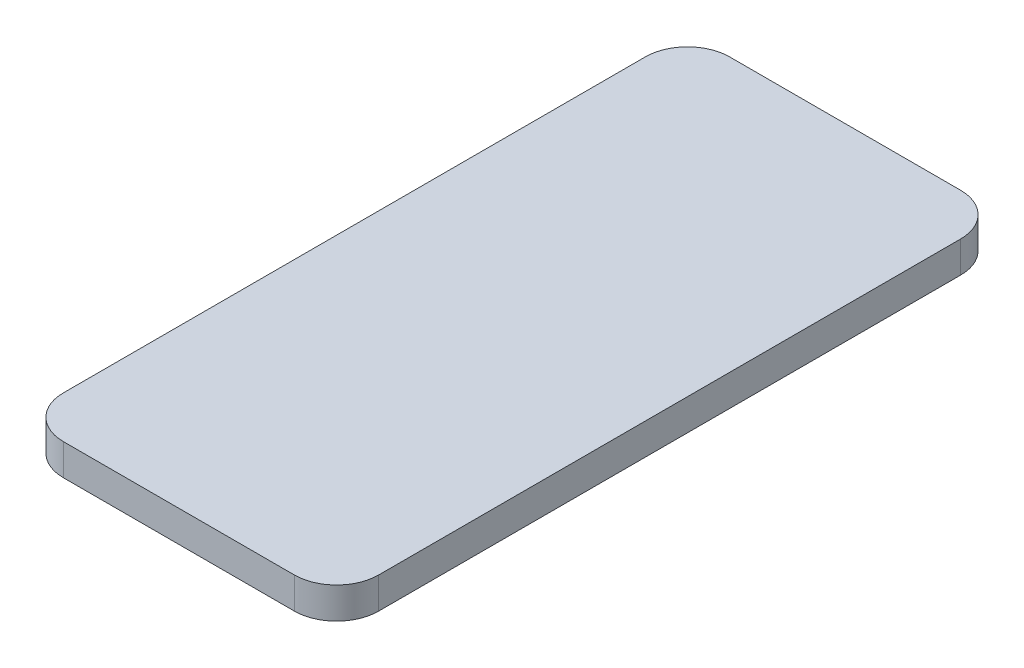
from build123d import *

# Parameters (mm, degrees)
F_01_PHONE_BODY_DEPTH = 7.42


with BuildPart() as part:
    # 草图1 → 01_PHONE_BODY (new body)
    with BuildSketch(Plane(origin=(0, 0, 0), x_dir=(1, 0, 0), z_dir=(0, 1, 0))):
        with BuildLine():
            Line((-27.365, 0), (27.365, 0))
            ThreePointArc((27.365, 0), (34.436067812, -2.928932188), (37.365, -10))
            Line((37.365, -10), (37.365, -147.9))
            ThreePointArc((37.365, -147.9), (34.436067812, -154.971067812), (27.365, -157.9))
            Line((27.365, -157.9), (-27.365, -157.9))
            ThreePointArc((-27.365, -157.9), (-34.436067812, -154.971067812), (-37.365, -147.9))
            Line((-37.365, -147.9), (-37.365, -10))
            ThreePointArc((-37.365, -10), (-34.436067812, -2.928932188), (-27.365, 0))
        make_face()
    extrude(amount=-F_01_PHONE_BODY_DEPTH)


solid = part.part
